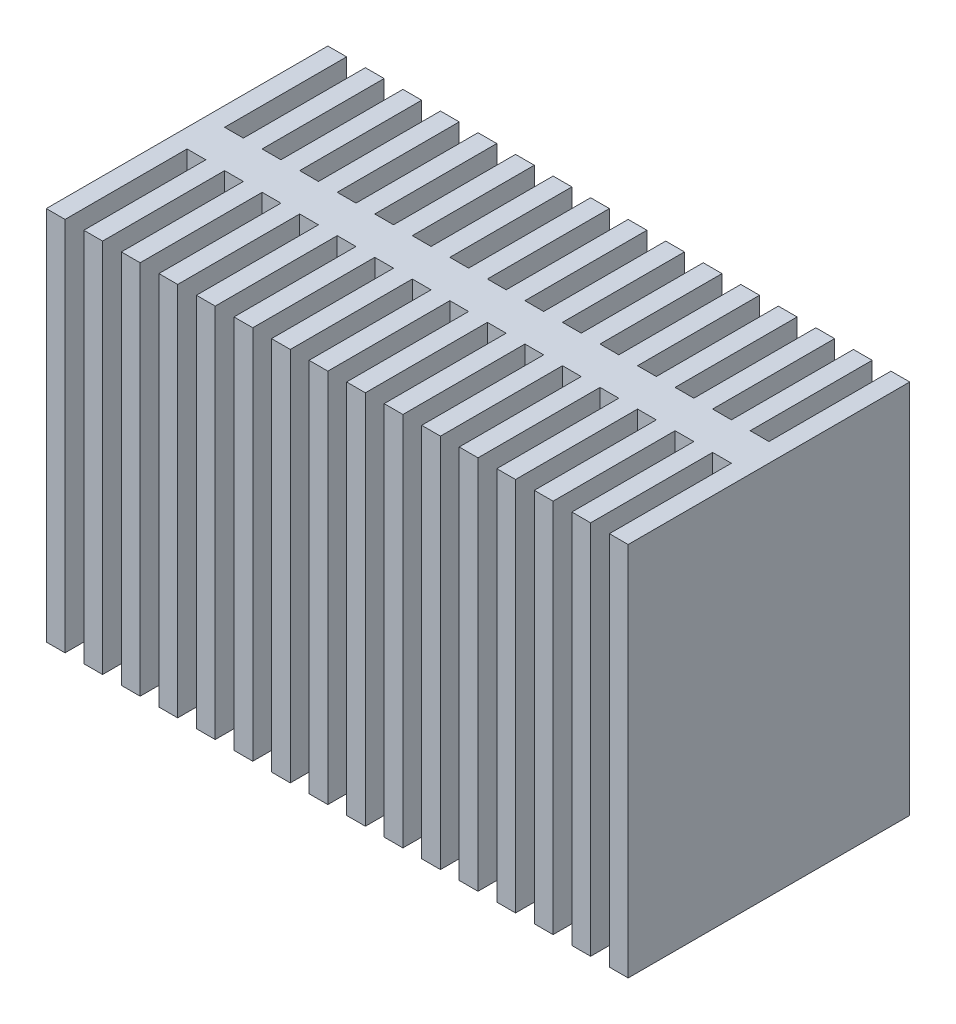
from build123d import *

# Parameters (mm, degrees)
BOSS_EXTRUDE1_DEPTH = 20


with BuildPart() as part:
    # Sketch2 → Boss-Extrude1 (new body)
    with BuildSketch(Plane(origin=(0, 0, 0), x_dir=(1, 0, 0), z_dir=(0, 1, 0))):
        Polygon((1, 0), (0, 0), (0, -15), (1, -15), (1, -8.5), (2, -8.5), (2, -15), (3, -15), (3, -8.5), (4, -8.5), (4, -15), (5, -15), (5, -8.5), (6, -8.5), (6, -15), (7, -15), (7, -8.5), (8, -8.5), (8, -15), (9, -15), (9, -8.5), (10, -8.5), (10, -15), (11, -15), (11, -8.5), (12, -8.5), (12, -15), (13, -15), (13, -8.5), (14, -8.5), (14, -15), (15, -15), (15, -8.5), (16, -8.5), (16, -15), (17, -15), (17, -8.5), (18, -8.5), (18, -15), (19, -15), (19, -8.5), (20, -8.5), (20, -15), (21, -15), (21, -8.5), (22, -8.5), (22, -15), (23, -15), (23, -8.5), (24, -8.5), (24, -15), (25, -15), (25, -8.5), (26, -8.5), (26, -15), (27, -15), (27, -8.5), (28, -8.5), (28, -15), (29, -15), (29, -8.5), (30, -8.5), (30, -15), (31, -15), (31, 0), (30, 0), (30, -6.5), (29, -6.5), (29, 0), (28, 0), (28, -6.5), (27, -6.5), (27, 0), (26, 0), (26, -6.5), (25, -6.5), (25, 0), (24, 0), (24, -6.5), (23, -6.5), (23, 0), (22, 0), (22, -6.5), (21, -6.5), (21, 0), (20, 0), (20, -6.5), (19, -6.5), (19, 0), (18, 0), (18, -6.5), (17, -6.5), (17, 0), (16, 0), (16, -6.5), (15, -6.5), (15, 0), (14, 0), (14, -6.5), (13, -6.5), (13, 0), (12, 0), (12, -6.5), (11, -6.5), (11, 0), (10, 0), (10, -6.5), (9, -6.5), (9, 0), (8, 0), (8, -6.5), (7, -6.5), (7, 0), (6, 0), (6, -6.5), (5, -6.5), (5, 0), (4, 0), (4, -6.5), (3, -6.5), (3, 0), (2, 0), (2, -6.5), (1, -6.5), align=None)
    extrude(amount=BOSS_EXTRUDE1_DEPTH)


solid = part.part
